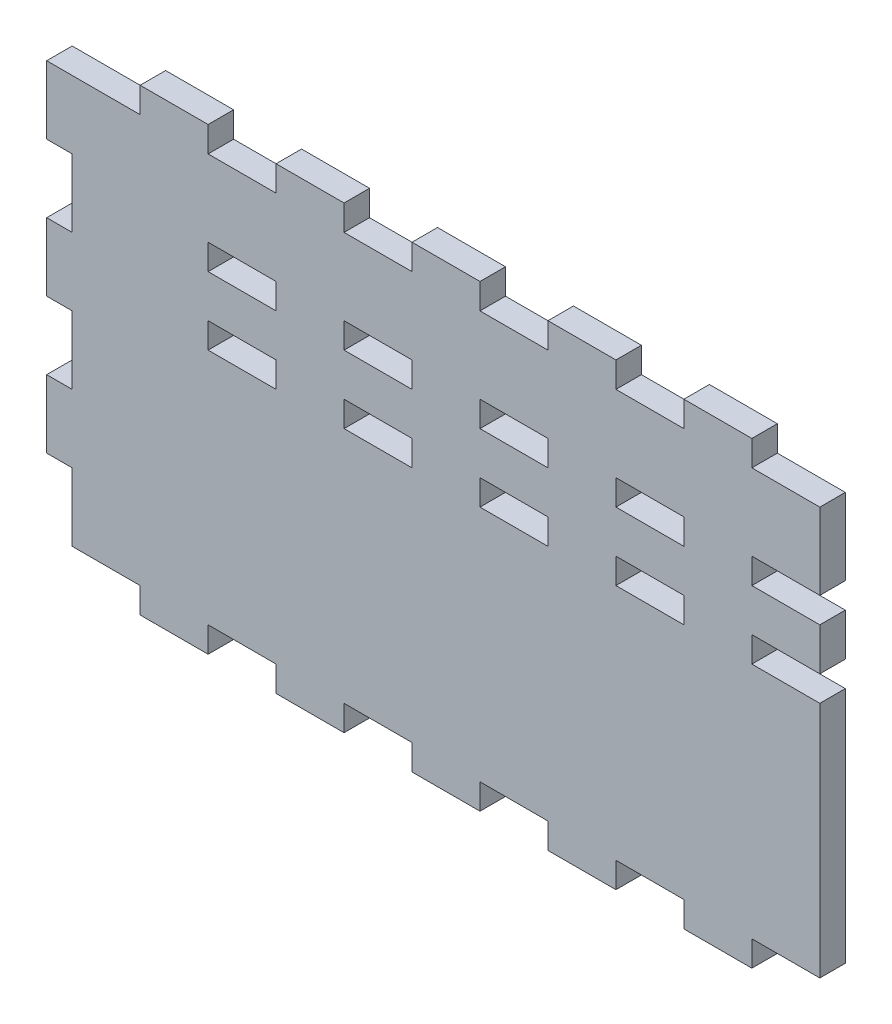
from build123d import *

# Parameters (mm, degrees)
SKETCH1_W               = 279.4
SKETCH1_H               = 152.4
BOSS_EXTRUDE1_DEPTH     = 9.525
SKETCH2_W               = 25.4
SKETCH2_H               = 9.525
BOSS_EXTRUDE2_DEPTH     = 9.525
LPATTERN1_COUNT         = 5
LPATTERN1_PITCH         = 50.8
MIRROR1_COPY_1_SKETCH_W = 25.4
MIRROR1_COPY_1_SKETCH_H = 9.525
MIRROR1_COPY_1_DEPTH    = 9.525
MIRROR1_COPY_2_SKETCH_W = 25.4
MIRROR1_COPY_2_SKETCH_H = 9.525
MIRROR1_COPY_2_DEPTH    = 9.525
MIRROR1_COPY_3_SKETCH_W = 25.4
MIRROR1_COPY_3_SKETCH_H = 9.525
MIRROR1_COPY_3_DEPTH    = 9.525
MIRROR1_COPY_4_SKETCH_W = 25.4
MIRROR1_COPY_4_SKETCH_H = 9.525
MIRROR1_COPY_4_DEPTH    = 9.525
MIRROR1_COPY_5_SKETCH_W = 25.4
MIRROR1_COPY_5_SKETCH_H = 9.525
MIRROR1_COPY_5_DEPTH    = 9.525
SKETCH3_W               = 9.525
SKETCH3_H               = 25.4
BOSS_EXTRUDE3_DEPTH     = 9.525
LPATTERN2_COUNT         = 3
LPATTERN2_PITCH         = 50.8
SKETCH4_W               = 25.4
SKETCH4_H               = 9.525
CUT_EXTRUDE1_DEPTH      = 173.358933261
LPATTERN3_COUNT         = 5
LPATTERN3_PITCH         = 50.8
SKETCH5_W               = 25.4
SKETCH5_H               = 9.525
CUT_EXTRUDE2_DEPTH      = 173.358933261
LPATTERN4_COUNT         = 5
LPATTERN4_PITCH         = 50.8


with BuildPart() as part:
    # Sketch1 → Boss-Extrude1 (new body)
    with BuildSketch(Plane.XY):
        Rectangle(SKETCH1_W, SKETCH1_H)
    extrude(amount=BOSS_EXTRUDE1_DEPTH)

    # Sketch2 → Boss-Extrude2 (add)
    with BuildSketch(Plane.XZ.offset(76.2)):
        with Locations((-101.6, 4.7625)):
            Rectangle(SKETCH2_W, SKETCH2_H)
    boss_extrude2 = extrude(amount=BOSS_EXTRUDE2_DEPTH)

    # LPattern1: Boss-Extrude2 ×5
    with Locations(*[(i * LPATTERN1_PITCH, 0, 0) for i in range(1, LPATTERN1_COUNT)]):
        add(boss_extrude2)

    # Mirror1 copy 1 sketch → Mirror1 copy 1 (add)
    with BuildSketch(Plane(origin=(50.8, 76.2, 0), x_dir=(1, 0, 0), z_dir=(0, 1, 0))):
        with Locations((-101.6, -4.7625)):
            Rectangle(MIRROR1_COPY_1_SKETCH_W, MIRROR1_COPY_1_SKETCH_H)
    extrude(amount=MIRROR1_COPY_1_DEPTH)

    # Mirror1 copy 2 sketch → Mirror1 copy 2 (add)
    with BuildSketch(Plane(origin=(101.6, 76.2, 0), x_dir=(1, 0, 0), z_dir=(0, 1, 0))):
        with Locations((-101.6, -4.7625)):
            Rectangle(MIRROR1_COPY_2_SKETCH_W, MIRROR1_COPY_2_SKETCH_H)
    extrude(amount=MIRROR1_COPY_2_DEPTH)

    # Mirror1 copy 3 sketch → Mirror1 copy 3 (add)
    with BuildSketch(Plane(origin=(152.4, 76.2, 0), x_dir=(1, 0, 0), z_dir=(0, 1, 0))):
        with Locations((-101.6, -4.7625)):
            Rectangle(MIRROR1_COPY_3_SKETCH_W, MIRROR1_COPY_3_SKETCH_H)
    extrude(amount=MIRROR1_COPY_3_DEPTH)

    # Mirror1 copy 4 sketch → Mirror1 copy 4 (add)
    with BuildSketch(Plane(origin=(203.2, 76.2, 0), x_dir=(1, 0, 0), z_dir=(0, 1, 0))):
        with Locations((-101.6, -4.7625)):
            Rectangle(MIRROR1_COPY_4_SKETCH_W, MIRROR1_COPY_4_SKETCH_H)
    extrude(amount=MIRROR1_COPY_4_DEPTH)

    # Mirror1 copy 5 sketch → Mirror1 copy 5 (add)
    with BuildSketch(Plane(origin=(0, 76.2, 0), x_dir=(1, 0, 0), z_dir=(0, 1, 0))):
        with Locations((-101.6, -4.7625)):
            Rectangle(MIRROR1_COPY_5_SKETCH_W, MIRROR1_COPY_5_SKETCH_H)
    extrude(amount=MIRROR1_COPY_5_DEPTH)

    # Sketch3 → Boss-Extrude3 (add)
    with BuildSketch(Plane.ZY.offset(139.7)):
        with Locations((4.7625, 63.5)):
            Rectangle(SKETCH3_W, SKETCH3_H)
    boss_extrude3 = extrude(amount=BOSS_EXTRUDE3_DEPTH)

    # LPattern2: Boss-Extrude3 ×3
    with Locations(*[(0, -i * LPATTERN2_PITCH, 0) for i in range(1, LPATTERN2_COUNT)]):
        add(boss_extrude3)

    # Sketch4 → Cut-Extrude1 (cut, through all)
    with BuildSketch(Plane(origin=(0, 0, 0), x_dir=(-1, 0, 0), z_dir=(0, 0, -1))):
        with Locations((-127, 17.4625)):
            Rectangle(SKETCH4_W, SKETCH4_H)
    cut_extrude1 = extrude(amount=-CUT_EXTRUDE1_DEPTH, mode=Mode.SUBTRACT)

    # LPattern3: Cut-Extrude1 ×5
    with Locations(*[(-i * LPATTERN3_PITCH, 0, 0) for i in range(1, LPATTERN3_COUNT)]):
        add(cut_extrude1, mode=Mode.SUBTRACT)

    # Sketch5 → Cut-Extrude2 (cut, through all)
    with BuildSketch(Plane.XY.offset(9.525)):
        with Locations((-76.2, 42.8625)):
            Rectangle(SKETCH5_W, SKETCH5_H)
    cut_extrude2 = extrude(amount=-CUT_EXTRUDE2_DEPTH, mode=Mode.SUBTRACT)

    # LPattern4: Cut-Extrude2 ×5
    with Locations(*[(i * LPATTERN4_PITCH, 0, 0) for i in range(1, LPATTERN4_COUNT)]):
        add(cut_extrude2, mode=Mode.SUBTRACT)


solid = part.part
